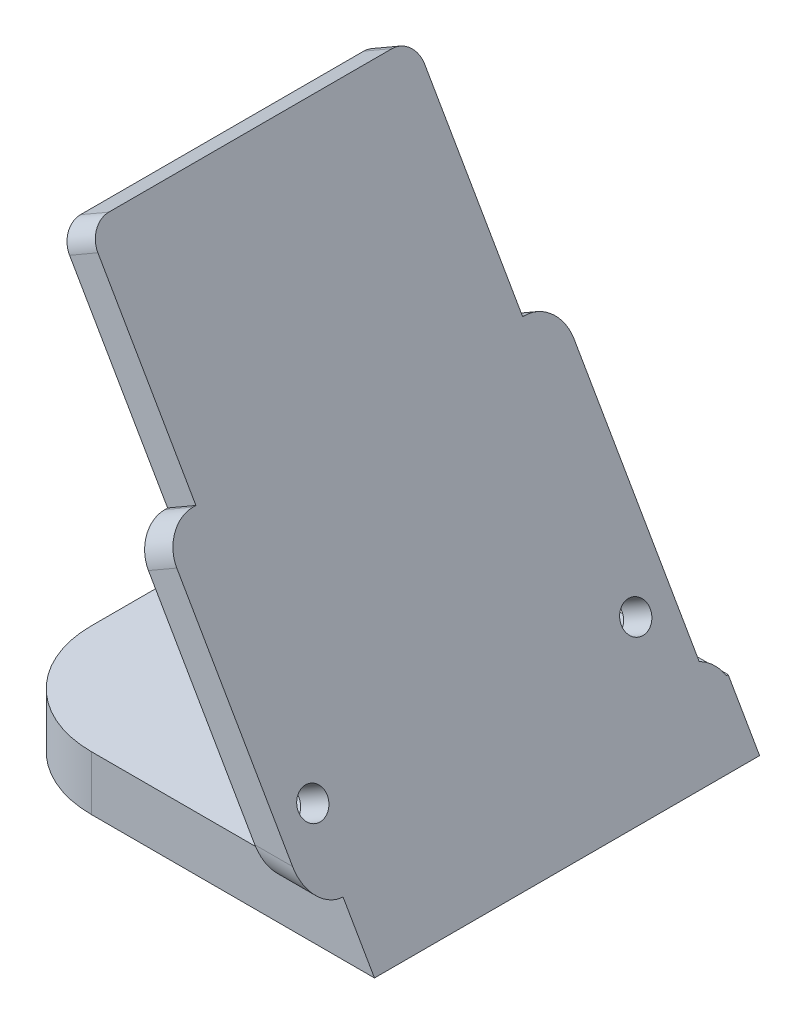
from build123d import *

# Parameters (mm, degrees)
EXTRUDE_1_DEPTH                  = 40
HOLE_START                       = 0.092539292
HOLE_WIZARD_3_0_2_65_1_OUTLINE_R = 1.325
HOLE_WIZARD_3_0_2_65_1_DEPTH     = 3
SKETCH_7_W                       = 5
SKETCH_7_H                       = 20
CUT_EXTRUDE_1_DEPTH              = 3
HOLE_START_2                     = -10.539590986
HOLE_WIZARD_3_0_2_65_2_OUTLINE_R = 1.325
HOLE_WIZARD_3_0_2_65_2_DEPTH     = 5
HOLE_WIZARD_3_0_2_65_3_OUTLINE_R = 1.325
HOLE_WIZARD_3_0_2_65_3_DEPTH     = 5
FILLET_3_R                       = 2
SKETCH_20_W                      = 36
SKETCH_20_H                      = 4.641244585
CUT_EXTRUDE_3_DEPTH              = 5
SKETCH_23_W                      = 1.741527355
SKETCH_23_H                      = 27.732050807
CUT_EXTRUDE_4_DEPTH              = 3
SKETCH_24_W                      = 1.79143138
SKETCH_24_H                      = 27.732050807
CUT_EXTRUDE_5_DEPTH              = 3
SKETCH_26_W                      = 1.79143138
SKETCH_26_H                      = 1.733650564
EXTRUDE_2_DEPTH                  = 3
FILLET_4_R                       = 10
FILLET_5_R                       = 3
FILLET_6_R                       = 3
FILLET_7_R                       = 3


# Read off the part's stored shape, not the designer's step: Ø3.0 (2.65) 直径孔1, Ø3.0 (2.65) 直径孔2, Ø3.0 (2.65) 直径孔3
with BuildPart() as part:
    # 草图1 → 凸台-拉伸1 (new body)
    with BuildSketch(Plane.XY):
        Polygon((-26.344007522, -10.539590986), (9.655992478, -10.539590986), (-17.096784272, 35.797577588), (-19.694860483, 34.297577588), (3.305139517, -5.539590986), (-26.344007522, -5.539590986), align=None)
    extrude(amount=EXTRUDE_1_DEPTH)

    # Ø3.0 (2.65) 直径孔1 outline → Ø3.0 (2.65) 直径孔1 (cut)
    with BuildSketch(Plane(origin=(0, 0, 0), x_dir=(0.500000000000004, -0.8660254037844363, 0), z_dir=(0.8660254037844363, 0.5000000000000042, 0)).offset(HOLE_START)):
        with Locations((1.719905554, -5.253562617)):
            Circle(HOLE_WIZARD_3_0_2_65_1_OUTLINE_R)
        with Locations((1.719905554, -34.903562617)):
            Circle(HOLE_WIZARD_3_0_2_65_1_OUTLINE_R)
    extrude(amount=HOLE_WIZARD_3_0_2_65_1_DEPTH, mode=Mode.SUBTRACT)

    # 草图7 → 切除-拉伸1 (cut)
    with BuildSketch(Plane(origin=(2.678217589, 1.546269646, 0), x_dir=(0, 0, -1), z_dir=(0.8660254037844364, 0.5000000000000041, 0))):
        with Locations((-37.5, 29.550003721)):
            Rectangle(SKETCH_7_W, SKETCH_7_H)
        with Locations((-2.5, 29.550003721)):
            Rectangle(SKETCH_7_W, SKETCH_7_H)
    extrude(amount=-CUT_EXTRUDE_1_DEPTH, mode=Mode.SUBTRACT)

    # Ø3.0 (2.65) 直径孔2 outline → Ø3.0 (2.65) 直径孔2 (cut)
    with BuildSketch(Plane(origin=(0, 0, 0), x_dir=(1, 0, 0), z_dir=(0, 1, 0)).offset(HOLE_START_2)):
        with Locations((-9.458240247, -3.522342215)):
            Circle(HOLE_WIZARD_3_0_2_65_2_OUTLINE_R)
        with Locations((-2.458240247, -3.522342215)):
            Circle(HOLE_WIZARD_3_0_2_65_2_OUTLINE_R)
    extrude(amount=HOLE_WIZARD_3_0_2_65_2_DEPTH, mode=Mode.SUBTRACT)

    # Ø3.0 (2.65) 直径孔3 outline → Ø3.0 (2.65) 直径孔3 (cut)
    with BuildSketch(Plane(origin=(0, 0, 0), x_dir=(1, 0, 0), z_dir=(0, 1, 0)).offset(HOLE_START_2)):
        with Locations((-1.947010607, -36.908916004)):
            Circle(HOLE_WIZARD_3_0_2_65_3_OUTLINE_R)
        with Locations((-8.947010607, -36.908916004)):
            Circle(HOLE_WIZARD_3_0_2_65_3_OUTLINE_R)
    extrude(amount=HOLE_WIZARD_3_0_2_65_3_DEPTH, mode=Mode.SUBTRACT)

    # 圆角3
    fillet_3_edges = [part.edges().sort_by_distance(p)[0] for p in [
        (-18.395822378, 35.047577588, 35),
        (-18.395822378, 35.047577588, 5),
    ]]
    fillet(fillet_3_edges, radius=FILLET_3_R)

    # 草图20 → 切除-拉伸3 (cut)
    with BuildSketch(Plane.XZ.offset(10.539590986)):
        with Locations((-8.344007522, 37.679377708)):
            Rectangle(SKETCH_20_W, SKETCH_20_H)
    extrude(amount=-CUT_EXTRUDE_3_DEPTH, mode=Mode.SUBTRACT)

    # 草图23 → 切除-拉伸4 (cut)
    with BuildSketch(Plane(origin=(2.678217589, 1.546269646, 0), x_dir=(0, 0, -1), z_dir=(0.8660254037844364, 0.5000000000000041, 0))):
        with Locations((-39.129236323, 5.683978317)):
            Rectangle(SKETCH_23_W, SKETCH_23_H)
    extrude(amount=-CUT_EXTRUDE_4_DEPTH, mode=Mode.SUBTRACT)

    # 草图24 → 切除-拉伸5 (cut)
    with BuildSketch(Plane(origin=(2.678217589, 1.546269646, 0), x_dir=(0, 0, -1), z_dir=(0.8660254037844364, 0.5000000000000041, 0))):
        with Locations((-0.89571569, 5.683978317)):
            Rectangle(SKETCH_24_W, SKETCH_24_H)
    extrude(amount=-CUT_EXTRUDE_5_DEPTH, mode=Mode.SUBTRACT)

    # 草图26 → 凸台-拉伸2 (add)
    with BuildSketch(Plane(origin=(0.080141377, 0.046269646, 0), x_dir=(0, 0, -1), z_dir=(0.8660254037844364, 0.5000000000000041, 0))):
        with Locations((-0.89571569, -7.316821561)):
            Rectangle(SKETCH_26_W, SKETCH_26_H)
    extrude(amount=EXTRUDE_2_DEPTH)

    # 圆角4
    fillet_4_edges = [part.edges().sort_by_distance(p)[0] for p in [
        (-26.344007522, -8.039590986, 35.358755415),
        (-26.344007522, -8.039590986, 0),
    ]]
    fillet(fillet_4_edges, radius=FILLET_4_R)

    # 圆角5
    fillet_5_edges = [part.edges().sort_by_distance(p)[0] for p in [
        (-8.395822378, 17.727069512, 38.258472645),
        (-8.395822378, 17.727069512, 1.79143138),
    ]]
    fillet(fillet_5_edges, radius=FILLET_5_R)

    # 圆角6
    # the kernel refuses this fillet: 3 mm, written as the material it takes off along each edge
    with BuildSketch(Plane(origin=(14.265049697, -5.539590986, 38.258472645), x_dir=(0, 0, -1), z_dir=(-1, 0, 0))) as fillet_6_piece_1:
        with BuildLine():
            CenterArc((3, -2.998323426), FILLET_6_R, 91.915616688, 88.084383312)
            Line((0, -2.998323426), (-0.06, -2.998323426))
            Line((-0.06, -2.998323426), (-0.06, 0))
            Line((-0.06, 0), (0, 0.06))
            ThreePointArc((0, 0.06), (1.449858615, 0.06), (2.897711575, 0.059966469))
            Line((2.897711575, 0.059966469), (2.89971723, 0))
        make_face()
    extrude(amount=18.455718744, mode=Mode.SUBTRACT)

    # 圆角7
    # the kernel refuses this fillet: 3 mm, written as the material it takes off along each edge
    with BuildSketch(Plane(origin=(-2.639669888, -8.971828296, 0), x_dir=(0, 0, 1), z_dir=(0.8660254037844363, 0.5000000000000041, 0))) as fillet_7_piece_1_section:
        with BuildLine():
            CenterArc((3, 2.745789848), FILLET_7_R, 180, 66.243144393)
            Line((0, 2.745789848), (0, 0))
            Line((0, 0), (1.79143138, 0))
        make_face()
    fillet_7_piece_1 = extrude(amount=16.728949241, mode=Mode.PRIVATE)
    fillet_7_piece_1 = split(fillet_7_piece_1, bisect_by=Plane(origin=(4.952096939, -5.539590986, 0.801424093), z_dir=(0, 1, 0)), keep=Keep.TOP, mode=Mode.PRIVATE)
    add(fillet_7_piece_1, mode=Mode.SUBTRACT)


solid = part.part
